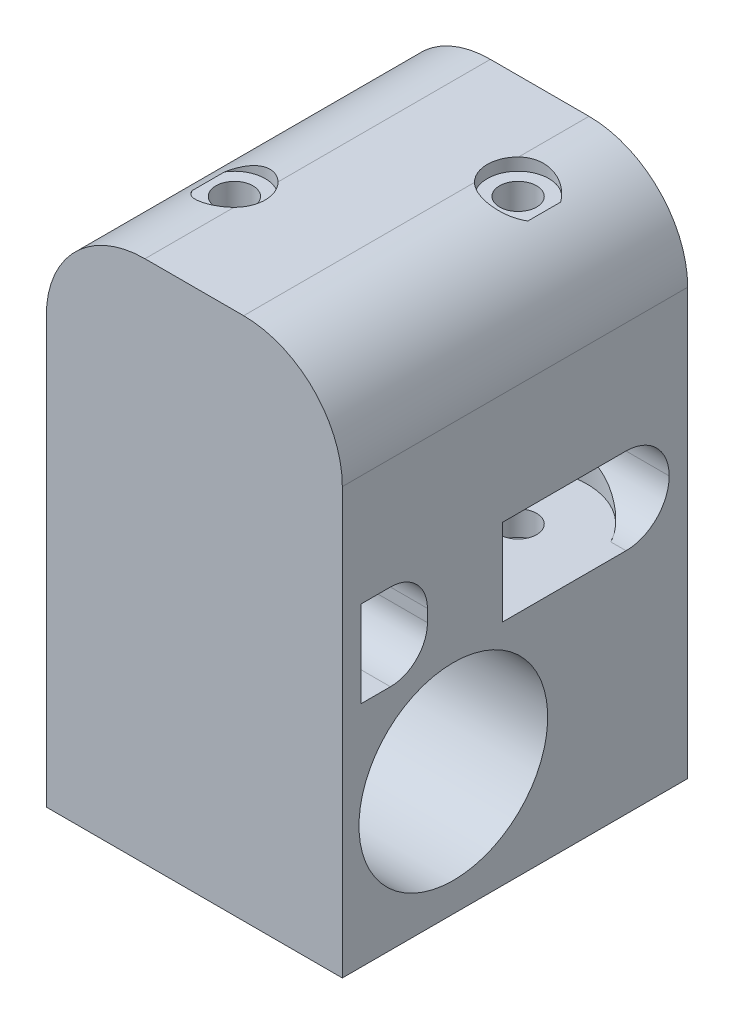
from build123d import *

# Parameters (mm, degrees)
SKETCH_1_W           = 24
SKETCH_1_H           = 36
EXTRUDE_1_DEPTH      = 19
CUT_EXTRUDE_2_DEPTH  = 3.5
SKETCH_4_W           = 5.4
SKETCH_4_H           = 7
CUT_EXTRUDE_3_DEPTH  = 36.510561809
CUT_EXTRUDE_4_DEPTH  = 3.5
SKETCH_6_R           = 4.15
CUT_EXTRUDE_5_DEPTH  = 44.726422218
FILLET_2_R           = 3
SKETCH_10_W          = 10
SKETCH_10_H          = 36
CUT_EXTRUDE_9_DEPTH  = 36.510561809
SKETCH_11_W          = 28
SKETCH_11_H          = 16.5
EXTRUDE_3_DEPTH      = 24
SKETCH_12_W          = 10.25
SKETCH_12_H          = 12
EXTRUDE_4_DEPTH      = 7
FILLET_3_R           = 3.5
SKETCH_13_W          = 10.25
SKETCH_13_H          = 1.5
EXTRUDE_5_DEPTH      = 7
FILLET_4_R           = 3.5
SKETCH_14_R          = 5.6
CUT_EXTRUDE_10_DEPTH = 7
FILLET_6_R           = 3
EXTRUDE_START        = -18
SKETCH_16_R          = 4.15
EXTRUDE_6_DEPTH      = 18
SKETCH_18_R          = 7.65
SKETCH_18_W          = 28
SKETCH_18_H          = 9
SKETCH_18_H_2        = 17.5
CUT_EXTRUDE_11_DEPTH = 47.122120558
FILLET_7_R           = 8
SKETCH_19_R          = 1.5
CUT_EXTRUDE_12_DEPTH = 26
SKETCH_20_R          = 1.5
CUT_EXTRUDE_13_DEPTH = 20
SKETCH_21_R          = 2.5
CUT_EXTRUDE_14_DEPTH = 1


with BuildPart() as part:
    # 草图1 → 凸台-拉伸1 (new, symmetric)
    with BuildSketch(Plane.XY):
        Rectangle(SKETCH_1_W, SKETCH_1_H)
    extrude(amount=EXTRUDE_1_DEPTH, both=True)

    # 草图3 → 切除-拉伸2 (cut, symmetric)
    with BuildSketch(Plane(origin=(0, 3.5, 0), x_dir=(1, 0, 0), z_dir=(0, 1, 0))):
        with BuildLine():
            Line((-5.75, -7.5), (-12, -7.5))
            Line((-12, -7.5), (-12, 19))
            Line((-12, 19), (1.75, 19))
            Line((1.75, 19), (1.75, 0))
            ThreePointArc((1.75, 0), (-0.446699141, -5.303300859), (-5.75, -7.5))
        make_face()
    extrude(amount=CUT_EXTRUDE_2_DEPTH, both=True, mode=Mode.SUBTRACT)

    # 草图4 → 切除-拉伸3 (cut, through all)
    with BuildSketch(Plane.ZY.offset(12)):
        with Locations((4.8, -3.5)):
            Rectangle(SKETCH_4_W, SKETCH_4_H)
    extrude(amount=-CUT_EXTRUDE_3_DEPTH, mode=Mode.SUBTRACT)

    # 草图5 → 切除-拉伸4 (cut, symmetric)
    with BuildSketch(Plane(origin=(0, -3.5, 0), x_dir=(1, 0, 0), z_dir=(0, 1, 0))):
        with BuildLine():
            Line((5.75, 4), (12, 4))
            Line((12, 4), (12, 19))
            Line((12, 19), (-1.75, 19))
            Line((-1.75, 19), (-1.75, 11.5))
            ThreePointArc((-1.75, 11.5), (0.446699141, 6.196699141), (5.75, 4))
        make_face()
    extrude(amount=CUT_EXTRUDE_4_DEPTH, both=True, mode=Mode.SUBTRACT)

    # 草图6 → 切除-拉伸5 (cut, through all)
    with BuildSketch(Plane(origin=(0, 0, -19), x_dir=(-1, 0, 0), z_dir=(0, 0, -1))):
        with Locations((0, 12)):
            Circle(SKETCH_6_R)
        with Locations(Location((0, -12, 0), (0, 0, 180))):
            Circle(SKETCH_6_R)
    extrude(amount=-CUT_EXTRUDE_5_DEPTH, mode=Mode.SUBTRACT)

    # 圆角2
    fillet_2_edges = [part.edges().sort_by_distance(p)[0] for p in [
        (6.725, 0, 2.1),
        (0, -7, 2.1),
    ]]
    fillet(fillet_2_edges, radius=FILLET_2_R)

    # 草图10 → 切除-拉伸9 (cut, through all)
    with BuildSketch(Plane(origin=(12, 0, 0), x_dir=(0, 0, -1), z_dir=(1, 0, 0))):
        with Locations((-14, 0)):
            Rectangle(SKETCH_10_W, SKETCH_10_H)
    extrude(amount=-CUT_EXTRUDE_9_DEPTH, mode=Mode.SUBTRACT)

    # 草图11 → 凸台-拉伸3 (add)
    with BuildSketch(Plane.ZY.offset(12)):
        with Locations((-5, -26.25)):
            Rectangle(SKETCH_11_W, SKETCH_11_H)
    extrude_3 = extrude(amount=-EXTRUDE_3_DEPTH)

    # 镜向2: 凸台-拉伸3 across plane
    add(extrude_3.mirror(Plane.ZX))

    # 草图12 → 凸台-拉伸4 (add)
    with BuildSketch(Plane(origin=(0, 0, 0), x_dir=(1, 0, 0), z_dir=(0, 1, 0))):
        with Locations((-6.875, 13)):
            Rectangle(SKETCH_12_W, SKETCH_12_H)
    extrude(amount=EXTRUDE_4_DEPTH)

    # 圆角3
    fillet_3_edges = [part.edges().sort_by_distance(p)[0] for p in [
        (-6.875, 0, -7),
        (-6.875, 7, -7),
    ]]
    fillet(fillet_3_edges, radius=FILLET_3_R - 0.0001)  # a hair under: the kernel refuses the full size

    # 草图13 → 凸台-拉伸5 (add)
    with BuildSketch(Plane.XZ):
        with Locations((6.875, -18.25)):
            Rectangle(SKETCH_13_W, SKETCH_13_H)
    extrude(amount=EXTRUDE_5_DEPTH)

    # 圆角4
    fillet_4_edges = [part.edges().sort_by_distance(p)[0] for p in [
        (6.875, 0, -17.5),
        (6.875, -7, -17.5),
    ]]
    fillet(fillet_4_edges, radius=FILLET_4_R - 0.0001)  # a hair under: the kernel refuses the full size

    # 草图14 → 切除-拉伸10 (cut)
    with BuildSketch(Plane.XZ):
        with Locations((5.75, -11.5)):
            Circle(SKETCH_14_R)
    extrude(amount=CUT_EXTRUDE_10_DEPTH, mode=Mode.SUBTRACT)

    # 圆角6
    fillet_6_edges = [part.edges().sort_by_distance(p)[0] for p in [
        (-5.275, 0, 2.1),
    ]]
    fillet(fillet_6_edges, radius=FILLET_6_R)

    # 草图16 → 凸台-拉伸6 (add)
    with BuildSketch(Plane.XY.offset(9).offset(EXTRUDE_START)):
        with Locations((0, -12)):
            Circle(SKETCH_16_R)
        with Locations(Location((0, 12, 0), (0, 0, 180))):
            Circle(SKETCH_16_R)
    extrude(amount=EXTRUDE_6_DEPTH)

    # 草图18 → 切除-拉伸11 (cut, through all)
    with BuildSketch(Plane.ZY.offset(12)):
        with Locations(Location((0, -15.5, 0), (0, 0, 270))):
            Circle(SKETCH_18_R)
        with Locations((-5, -30)):
            Rectangle(SKETCH_18_W, SKETCH_18_H)
        with Locations((-5, 25.75)):
            Rectangle(SKETCH_18_W, SKETCH_18_H_2)
    extrude(amount=-CUT_EXTRUDE_11_DEPTH, mode=Mode.SUBTRACT)

    # 圆角7
    fillet_7_edges = [part.edges().sort_by_distance(p)[0] for p in [
        (12, 17, -5),
        (-12, 17, -5),
    ]]
    fillet(fillet_7_edges, radius=FILLET_7_R)

    # 草图19 → 切除-拉伸12 (cut)
    with BuildSketch(Plane(origin=(0, 17, 0), x_dir=(1, 0, 0), z_dir=(0, 1, 0))):
        with Locations(Location((5.75, 11.5, 0), (0, 0, 180))):
            Circle(SKETCH_19_R)
    extrude(amount=-CUT_EXTRUDE_12_DEPTH, mode=Mode.SUBTRACT)

    # 草图20 → 切除-拉伸13 (cut)
    with BuildSketch(Plane(origin=(0, 17, 0), x_dir=(1, 0, 0), z_dir=(0, 1, 0))):
        with Locations(Location((-5.75, 0, 0), (0, 0, 180))):
            Circle(SKETCH_20_R)
    extrude(amount=-CUT_EXTRUDE_13_DEPTH, mode=Mode.SUBTRACT)

    # 草图21 → 切除-拉伸14 (cut)
    with BuildSketch(Plane(origin=(0, 17, 0), x_dir=(1, 0, 0), z_dir=(0, 1, 0))):
        with Locations((5.75, 11.5)):
            Circle(SKETCH_21_R)
        with Locations((-5.75, 0)):
            Circle(SKETCH_21_R)
    extrude(amount=-CUT_EXTRUDE_14_DEPTH, mode=Mode.SUBTRACT)


solid = part.part
